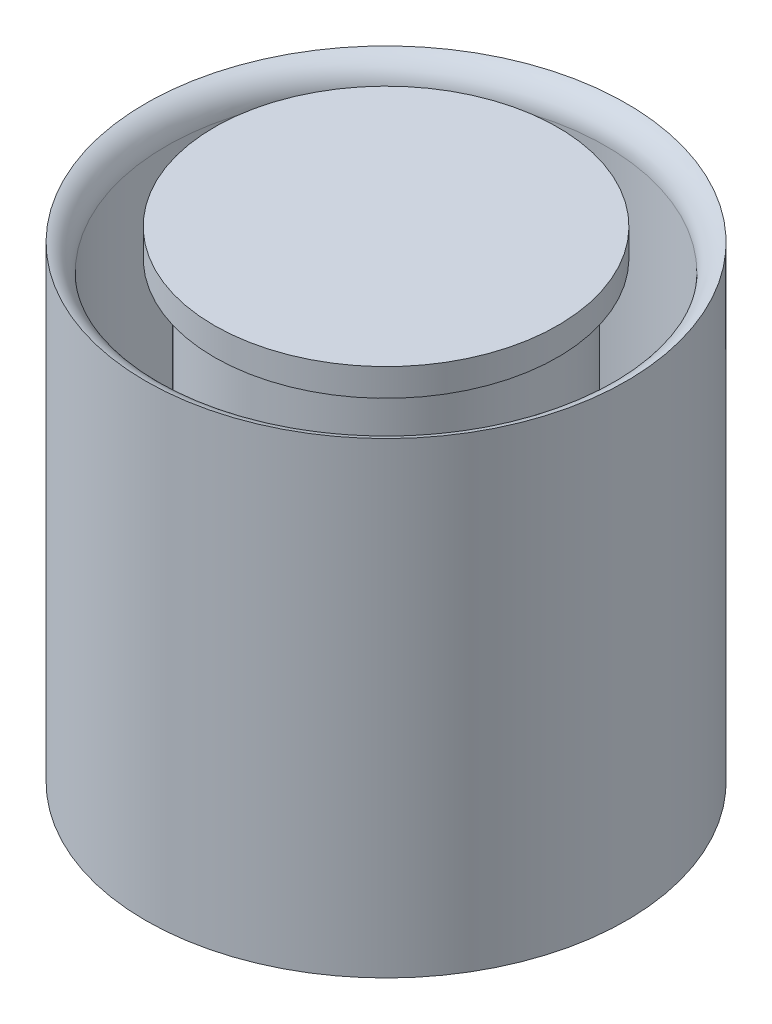
from build123d import *

# Parameters (mm, degrees)
SKETCH1_R           = 17.5
SKETCH1_R_2         = 16
BOSS_EXTRUDE1_DEPTH = 34
SKETCH2_R           = 17.5
BOSS_EXTRUDE2_DEPTH = 3
FILLET1_R           = 2
SKETCH3_R           = 11
BOSS_EXTRUDE3_DEPTH = 30
CUT_EXTRUDE1_DEPTH  = 35
SKETCH6_W           = 7.99098924
SKETCH6_H           = 6.392791393
BOSS_EXTRUDE4_DEPTH = 24
FILLET3_R           = 1.5
SKETCH8_R           = 12.5
BOSS_EXTRUDE5_DEPTH = 2


with BuildPart() as part:
    # Sketch1 → Boss-Extrude1 (new body)
    with BuildSketch(Plane(origin=(0, 0, 0), x_dir=(1, 0, 0), z_dir=(0, 1, 0))):
        with Locations(Location((0, 0, 0), (0, 0, 270))):
            Circle(SKETCH1_R)
        with Locations(Location((0, 0, 0), (0, 0, 270))):
            Circle(SKETCH1_R_2, mode=Mode.SUBTRACT)
    extrude(amount=BOSS_EXTRUDE1_DEPTH)

    # Sketch2 → Boss-Extrude2 (add)
    with BuildSketch(Plane(origin=(0, 0, 0), x_dir=(1, 0, 0), z_dir=(0, 1, 0))):
        with Locations(Location((0, 0, 0), (0, 0, 270))):
            Circle(SKETCH2_R)
    extrude(amount=BOSS_EXTRUDE2_DEPTH)

    # Fillet1
    # the kernel refuses this fillet: 2 mm, written as the material it takes off along each edge
    with BuildSketch(Plane(origin=(0, 34, 0), x_dir=(0, 0, 1), z_dir=(-1, 0, 0))) as fillet1_piece_1:
        with BuildLine():
            CenterArc((18, -1.936491673), FILLET1_R, 104.477512186, 75.522487814)
            Line((16, -1.936491673), (15.96, -1.936491673))
            Line((15.96, -1.936491673), (15.96, 0))
            Line((15.96, 0), (16, 0.04))
            ThreePointArc((16, 0.04), (16.75, 0.04), (17.49, 0.038729833))
            Line((17.49, 0.038729833), (17.5, 0))
        make_face()
    revolve(axis=Axis((0, 34, 0), (0, 1, 0)), mode=Mode.SUBTRACT)

    # Sketch3 → Boss-Extrude3 (add)
    with BuildSketch(Plane(origin=(0, 3, 0), x_dir=(1, 0, 0), z_dir=(0, 1, 0))):
        with Locations(Location((0, 0, 0), (0, 0, 270))):
            Circle(SKETCH3_R)
    extrude(amount=BOSS_EXTRUDE3_DEPTH)

    # Sketch5 → Cut-Extrude1 (cut)
    with BuildSketch(Plane(origin=(0, 33, 0), x_dir=(1, 0, 0), z_dir=(0, 1, 0))):
        with BuildLine():
            Line((-1.077438314, 1.385334501), (1.077438314, 1.385334501))
            ThreePointArc((1.077438314, 1.385334501), (0, -1.755), (-1.077438314, 1.385334501))
        make_face()
    extrude(amount=-CUT_EXTRUDE1_DEPTH, mode=Mode.SUBTRACT)

    # Sketch6 → Boss-Extrude4 (add)
    with BuildSketch(Plane(origin=(0, 33, 0), x_dir=(1, 0, 0), z_dir=(0, 1, 0))):
        with Locations((0.014035957, -0.788514839)):
            Rectangle(SKETCH6_W, SKETCH6_H)
    extrude(amount=-BOSS_EXTRUDE4_DEPTH)

    # Fillet3
    fillet3_edges = [part.edges().sort_by_distance(p)[0] for p in [
        (0, 3, -11),
    ]]
    fillet(fillet3_edges, radius=FILLET3_R)

    # Sketch8 → Boss-Extrude5 (add)
    with BuildSketch(Plane(origin=(0, 33, 0), x_dir=(1, 0, 0), z_dir=(0, 1, 0))):
        with Locations(Location((0, 0, 0), (0, 0, 270))):
            Circle(SKETCH8_R)
    extrude(amount=BOSS_EXTRUDE5_DEPTH)


solid = part.part
